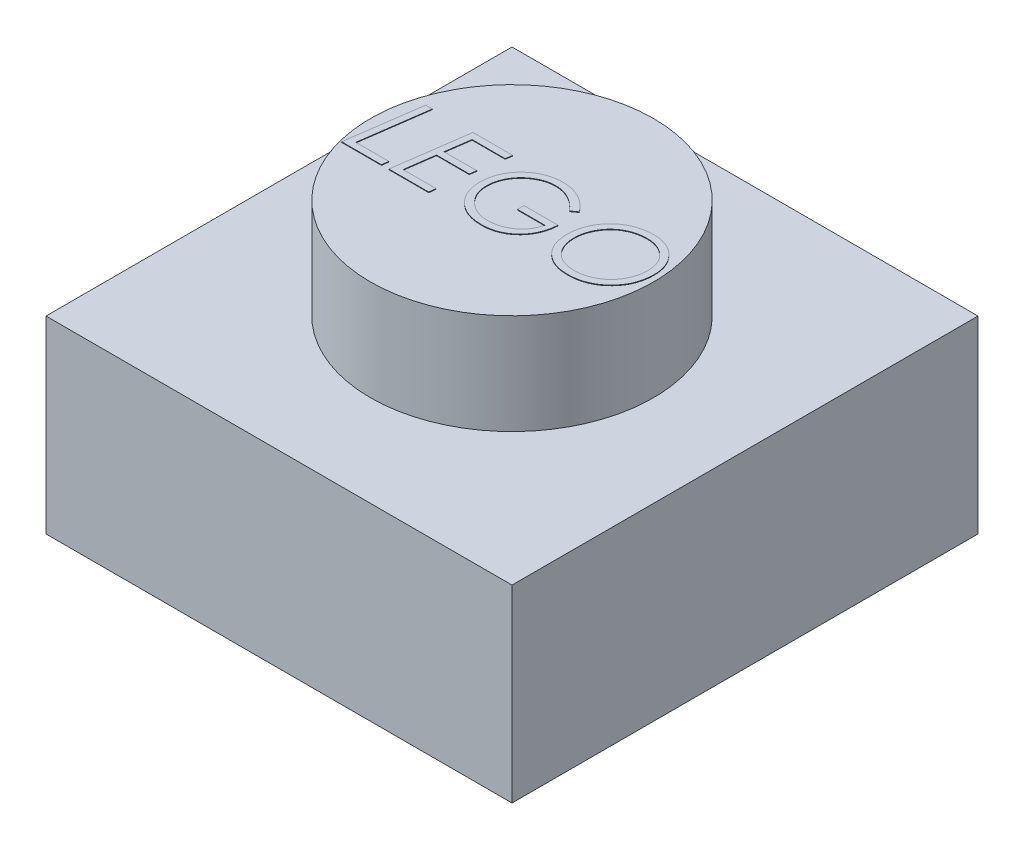
from build123d import *

# Parameters (mm, degrees)
SKETCH1_W           = 7.9
SKETCH1_H           = 7.9
BOSS_EXTRUDE1_DEPTH = 3.2
SKETCH2_R           = 2.4
BOSS_EXTRUDE2_DEPTH = 1.7
BOSS_EXTRUDE4_DEPTH = 0.01
SKETCH4_W           = 6.679581062
SKETCH4_H           = 6.679581062
CUT_EXTRUDE1_DEPTH  = 2.01
BOSS_EXTRUDE5_START = -2.01
SKETCH5_R           = 1.021947204
SKETCH5_R_2         = 1.041114876
SKETCH5_R_3         = 1.016069602
BOSS_EXTRUDE5_DEPTH = 2.01


with BuildPart() as part:
    # Sketch1 → Boss-Extrude1 (new body)
    with BuildSketch(Plane(origin=(0, 0, 0), x_dir=(1, 0, 0), z_dir=(0, 1, 0))):
        with Locations((3.95, 3.95)):
            Rectangle(SKETCH1_W, SKETCH1_H)
    extrude(amount=BOSS_EXTRUDE1_DEPTH)

    # Sketch2 → Boss-Extrude2 (add)
    with BuildSketch(Plane(origin=(0, 3.2, 0), x_dir=(1, 0, 0), z_dir=(0, 1, 0))):
        with Locations((3.95, 3.95)):
            Circle(SKETCH2_R)
    extrude(amount=BOSS_EXTRUDE2_DEPTH)

    # Sketch3 → Boss-Extrude4 (add)
    # profile 1 of 4: a face of its own
    with BuildSketch(Plane(origin=(0, 4.9, 0), x_dir=(1, 0, 0), z_dir=(0, 1, 0))):
        Polygon((1.832282536, 4.604898123), (1.945463626, 4.604898123), (1.785708017, 3.46707761), (2.346104652, 3.46707761), (2.331831815, 3.354898123), (1.657002088, 3.354898123), align=None)
    # profile 2 of 4: a face of its own
    with BuildSketch(Plane(origin=(0, 4.9, 0), x_dir=(1, 0, 0), z_dir=(0, 1, 0))):
        Polygon((3.307643113, 4.604898123), (3.289864668, 4.492718636), (2.730720036, 4.492718636), (2.672376687, 4.076051969), (3.227514908, 4.076051969), (3.211489267, 3.963872482), (2.656351046, 3.963872482), (2.586990069, 3.46707761), (3.147386703, 3.46707761), (3.132863466, 3.354898123), (2.458284139, 3.354898123), (2.633564588, 4.604898123), align=None)
    # profile 3 of 4: a face of its own
    with BuildSketch(Plane(origin=(0, 4.9, 0), x_dir=(1, 0, 0), z_dir=(0, 1, 0))):
        with BuildLine():
            Line((4.701873883, 4.341727049), (4.602214428, 4.268359661))
            add(Edge.make_bspline(
                [(4.602214428, 4.268359661), (4.594223081, 4.278463296), (4.578382454, 4.298490949), (4.552974208, 4.326751799), (4.526781942, 4.353389692), (4.49925824, 4.377917229), (4.471083571, 4.40112998), (4.441525281, 4.42204341), (4.410978563, 4.441207159), (4.379659496, 4.458649755), (4.347610579, 4.474125482), (4.315396207, 4.487732834), (4.282869127, 4.498922357), (4.250283005, 4.50864136), (4.217299487, 4.51587276), (4.18414763, 4.520710487), (4.150903008, 4.524293062), (4.128633082, 4.524610402), (4.117438786, 4.524769918)],
                knots=[0, 0, 0, 0, 1.088205139, 2.157064813, 3.209299296, 4.24303109, 5.270682624, 6.292193363, 7.299904734, 8.316436989, 9.319473328, 10.305733085, 11.269264382, 12.22444877, 13.177574148, 14.119122834, 15.054550362, 16, 16, 16, 16], degree=3))
            add(Edge.make_bspline(
                [(4.117438786, 4.524769918), (4.104994375, 4.524521107), (4.080132736, 4.524024028), (4.043033101, 4.520256885), (4.006376299, 4.51354748), (3.969908323, 4.504926578), (3.933893833, 4.493301772), (3.898252767, 4.479273564), (3.86309309, 4.462612711), (3.828430169, 4.443710217), (3.794953431, 4.422557236), (3.762954424, 4.399818018), (3.733183783, 4.375017311), (3.704650221, 4.34913067), (3.678490591, 4.320990985), (3.654040353, 4.291325456), (3.631570613, 4.259970376), (3.610753816, 4.22729124), (3.592321888, 4.193377608), (3.576332398, 4.158696131), (3.562301633, 4.123622124), (3.551463822, 4.087613068), (3.542488613, 4.051135011), (3.536702509, 4.013925289), (3.532682003, 3.976230124), (3.532229884, 3.950862463), (3.532002088, 3.938081216)],
                knots=[0, 0, 0, 0, 0.97704485, 1.95195533, 2.923843304, 3.901415526, 4.89212417, 5.89249681, 6.906854198, 7.94508701, 8.99059592, 10.014519948, 11.024825533, 12.031297736, 13.037428488, 14.038509295, 15.047964276, 16.064309815, 17.079005887, 18.075937854, 19.061713623, 20.042247028, 21.026191147, 22.008802999, 22.996754876, 24, 24, 24, 24], degree=3))
            add(Edge.make_bspline(
                [(3.532002088, 3.938081216), (3.532369323, 3.920940483), (3.533092921, 3.887166428), (3.54080397, 3.83756171), (3.552297071, 3.789703796), (3.569345009, 3.743984102), (3.590663785, 3.700113704), (3.616898701, 3.658340736), (3.647995923, 3.618632516), (3.683169388, 3.581124089), (3.721975609, 3.547190184), (3.762989457, 3.517071082), (3.806208637, 3.491553815), (3.851780792, 3.471217023), (3.899058754, 3.454481236), (3.948703848, 3.443615036), (4.000192874, 3.436168993), (4.035279814, 3.435410998), (4.053085822, 3.435026328)],
                knots=[0, 0, 0, 0, 1.019699772, 2.00921373, 2.981850619, 3.945611549, 4.907936516, 5.881372837, 6.876399243, 7.906447893, 8.938173367, 9.941073143, 10.932270214, 11.919723139, 12.908225854, 13.912405215, 14.940582182, 16, 16, 16, 16], degree=3))
            add(Edge.make_bspline(
                [(4.053085822, 3.435026328), (4.074581254, 3.435599426), (4.11748625, 3.436743331), (4.180872469, 3.447608002), (4.243162184, 3.464003995), (4.303115661, 3.48756372), (4.359892332, 3.516274774), (4.411741714, 3.54979345), (4.457784869, 3.587961635), (4.498384943, 3.630580026), (4.53303885, 3.678554542), (4.563120551, 3.731230233), (4.587740602, 3.789373269), (4.599634966, 3.830601123), (4.605720036, 3.851692995)],
                knots=[0, 0, 0, 0, 1.033792167, 2.063454529, 3.086685911, 4.12966393, 5.157365104, 6.144632769, 7.094686579, 8.02963692, 8.969786061, 9.935985671, 10.944065236, 12, 12, 12, 12], degree=3))
            Line((4.605720036, 3.851692995), (4.140976447, 3.851692995))
            Line((4.140976447, 3.851692995), (4.140976447, 3.963872482))
            Line((4.140976447, 3.963872482), (4.717899524, 3.963872482))
            add(Edge.make_bspline(
                [(4.717899524, 3.963872482), (4.715864452, 3.940537279), (4.711874195, 3.894782885), (4.69942647, 3.828086612), (4.68199329, 3.764774229), (4.659173945, 3.704861641), (4.630919519, 3.648505742), (4.59774963, 3.595348644), (4.559285746, 3.545571633), (4.515814341, 3.499721655), (4.46844757, 3.458302738), (4.417878433, 3.421925394), (4.364351012, 3.391393009), (4.308182236, 3.366007973), (4.248908241, 3.346854494), (4.187007442, 3.33278705), (4.12217798, 3.324364805), (4.078067373, 3.323359246), (4.055589828, 3.322846841)],
                knots=[0, 0, 0, 0, 1.098006248, 2.152910829, 3.176693714, 4.174102283, 5.154427425, 6.128677043, 7.108165613, 8.099464247, 9.087077226, 10.054952015, 11.015803916, 11.972468591, 12.940477937, 13.931877037, 14.946141749, 16, 16, 16, 16], degree=3))
            add(Edge.make_bspline(
                [(4.055589828, 3.322846841), (4.032525547, 3.323342362), (3.987411429, 3.324311611), (3.9214857, 3.332876212), (3.858807865, 3.34620412), (3.799404334, 3.365318809), (3.743277296, 3.389857102), (3.690679177, 3.420179827), (3.641268759, 3.455657405), (3.595689928, 3.496348401), (3.554559756, 3.541197331), (3.518567584, 3.589307242), (3.487743642, 3.639999747), (3.462901044, 3.693721351), (3.443468533, 3.750181555), (3.429856098, 3.809437188), (3.421311108, 3.871476007), (3.420325278, 3.913764014), (3.419822601, 3.935326809)],
                knots=[0, 0, 0, 0, 1.117903688, 2.186638197, 3.21780727, 4.221242465, 5.20706516, 6.182431358, 7.159609539, 8.151436913, 9.139682433, 10.10533578, 11.060397566, 12.011007066, 12.969638005, 13.950363306, 14.954883424, 16, 16, 16, 16], degree=3))
            add(Edge.make_bspline(
                [(3.419822601, 3.935326809), (3.420138952, 3.950859376), (3.420767729, 3.981731803), (3.424963713, 4.027616327), (3.432679126, 4.072646659), (3.442852825, 4.116910735), (3.455965552, 4.160496846), (3.471933961, 4.20328178), (3.491087489, 4.245242481), (3.513047729, 4.286115161), (3.537530339, 4.325600602), (3.564271155, 4.363247138), (3.593498243, 4.398542313), (3.624507556, 4.432098501), (3.658146201, 4.463054417), (3.693847346, 4.491888255), (3.731480716, 4.518905381), (3.77142415, 4.543221398), (3.812846375, 4.565137356), (3.855118915, 4.584605211), (3.898469674, 4.600573637), (3.942428974, 4.613905323), (3.987291028, 4.624144078), (4.032916476, 4.631801844), (4.079465257, 4.63599767), (4.110753822, 4.636631416), (4.12645321, 4.636949405)],
                knots=[0, 0, 0, 0, 1.01034602, 2.008157081, 2.993527994, 3.979930372, 4.960683832, 5.951959865, 6.948100503, 7.958563211, 8.967975239, 9.968308804, 10.959584837, 11.946808627, 12.938010319, 13.930059161, 14.930392727, 15.949048275, 16.969091794, 17.977364349, 18.973726886, 19.971641333, 20.963333569, 21.964771492, 22.978801278, 24, 24, 24, 24], degree=3))
            add(Edge.make_bspline(
                [(4.12645321, 4.636949405), (4.140647989, 4.63666956), (4.168739982, 4.636115737), (4.210476499, 4.63288549), (4.251380819, 4.627152534), (4.29129634, 4.618801418), (4.330484053, 4.608567941), (4.368675988, 4.59577053), (4.406070924, 4.580754735), (4.442474857, 4.563343269), (4.478143584, 4.543914061), (4.512619765, 4.521658579), (4.546625807, 4.497640881), (4.579591338, 4.471153536), (4.611552577, 4.442077414), (4.642675265, 4.410871755), (4.673242279, 4.377555225), (4.692243855, 4.353777591), (4.701873883, 4.341727049)],
                knots=[0, 0, 0, 0, 1.015105213, 2.008930748, 2.991454354, 3.966534974, 4.923490216, 5.886087319, 6.844809209, 7.803252371, 8.770243484, 9.747130909, 10.735853235, 11.746297741, 12.768902994, 13.824016992, 14.897208497, 16, 16, 16, 16], degree=3))
        make_face()
    # profile 4 of 4: a face of its own
    with BuildSketch(Plane(origin=(0, 4.9, 0), x_dir=(1, 0, 0), z_dir=(0, 1, 0))):
        with BuildLine():
            add(Edge.make_bspline(
                [(5.671925966, 4.636949405), (5.692400623, 4.63650345), (5.732667893, 4.635626396), (5.791703582, 4.627669814), (5.84816478, 4.614697282), (5.901922783, 4.596339067), (5.953136821, 4.572927607), (6.001690741, 4.544284414), (6.047399306, 4.510158163), (6.09025375, 4.471611385), (6.129154607, 4.429051867), (6.163160058, 4.383201547), (6.192058383, 4.334734533), (6.215910086, 4.283554512), (6.233823478, 4.229366588), (6.246743033, 4.172603876), (6.255145963, 4.113110877), (6.255950492, 4.072491917), (6.256361062, 4.051763107)],
                knots=[0, 0, 0, 0, 1.061681398, 2.087996504, 3.083659545, 4.062660971, 5.02945529, 5.999994507, 6.981138296, 7.983640916, 8.985844288, 9.966988076, 10.939736476, 11.908342154, 12.890058995, 13.894159216, 14.925339913, 16, 16, 16, 16], degree=3))
            add(Edge.make_bspline(
                [(6.256361062, 4.051763107), (6.25623821, 4.038988627), (6.255995471, 4.01374805), (6.253408976, 3.976225127), (6.249128591, 3.939561124), (6.243455349, 3.903597875), (6.235835613, 3.868539787), (6.226924527, 3.834140064), (6.216051359, 3.800598383), (6.20384118, 3.767696929), (6.189792262, 3.735595516), (6.173946521, 3.704324105), (6.15669213, 3.673663515), (6.137607818, 3.643838863), (6.11686312, 3.614849105), (6.094393683, 3.586665409), (6.070489857, 3.559187301), (6.044887258, 3.532733386), (6.018336956, 3.507212599), (5.990529993, 3.48355884), (5.962091012, 3.461350566), (5.932834084, 3.440746086), (5.90250067, 3.422121085), (5.871581935, 3.404690573), (5.839905885, 3.388861691), (5.807185809, 3.375183309), (5.773789823, 3.362832151), (5.739620564, 3.352089492), (5.704582969, 3.343076229), (5.668762424, 3.335500733), (5.632062087, 3.329787275), (5.594535036, 3.325855801), (5.556279304, 3.323200874), (5.530454147, 3.322965537), (5.51742877, 3.322846841)],
                knots=[0, 0, 0, 0, 1.057694632, 2.089855924, 3.112648636, 4.113725536, 5.103331559, 6.082381806, 7.055068159, 8.021768845, 8.98743121, 9.954922249, 10.923671581, 11.89959402, 12.885451751, 13.874212627, 14.883322035, 15.900071676, 16.921812937, 17.931632203, 18.921551953, 19.909055848, 20.892997665, 21.867769094, 22.84762411, 23.823252803, 24.802912784, 25.795362855, 26.787788858, 27.797679081, 28.826061376, 29.861826465, 30.921574152, 32, 32, 32, 32], degree=3))
            add(Edge.make_bspline(
                [(5.51742877, 3.322846841), (5.495540081, 3.323312388), (5.45279647, 3.324221496), (5.390401025, 3.331753811), (5.331466149, 3.34468508), (5.275615882, 3.361975519), (5.223270197, 3.38492417), (5.174339628, 3.412892082), (5.128783581, 3.445910526), (5.086763869, 3.483632016), (5.049135515, 3.525626819), (5.016044394, 3.570822838), (4.988418107, 3.619388761), (4.96538613, 3.670881503), (4.948106883, 3.725740589), (4.935156589, 3.783416472), (4.927613141, 3.844314319), (4.926699871, 3.88597706), (4.926232857, 3.907281937)],
                knots=[0, 0, 0, 0, 1.121422378, 2.189881799, 3.214223923, 4.209829567, 5.180887389, 6.136870002, 7.092517675, 8.058664933, 9.02481219, 9.976998316, 10.923432162, 11.882748215, 12.86205079, 13.865508147, 14.908495107, 16, 16, 16, 16], degree=3))
            add(Edge.make_bspline(
                [(4.926232857, 3.907281937), (4.92651465, 3.92390256), (4.927073619, 3.956871533), (4.931757127, 4.005792823), (4.939128338, 4.053761359), (4.950024433, 4.100549976), (4.963594459, 4.14639076), (4.979990494, 4.191253803), (5.000003008, 4.234848241), (5.022452359, 4.277389438), (5.047513645, 4.318359564), (5.07559856, 4.356880644), (5.105216605, 4.393691441), (5.137816677, 4.42780852), (5.172496353, 4.459796588), (5.209524734, 4.489546335), (5.248906172, 4.516814917), (5.290422211, 4.541753927), (5.333531205, 4.564369022), (5.378335052, 4.583562961), (5.424193072, 4.600182058), (5.471345954, 4.613795807), (5.519847317, 4.623918047), (5.569406413, 4.631466127), (5.620254649, 4.636113027), (5.6545551, 4.636668231), (5.671925966, 4.636949405)],
                knots=[0, 0, 0, 0, 1.027038055, 2.037251559, 3.03463374, 4.024476576, 5.003805404, 5.987972729, 6.973761106, 7.966047439, 8.95963362, 9.938921687, 10.910571097, 11.877553313, 12.852319973, 13.824735949, 14.81069978, 15.81041387, 16.816403723, 17.816876174, 18.82042938, 19.829469955, 20.847307225, 21.880377804, 22.926554263, 24, 24, 24, 24], degree=3))
        make_face()
        with BuildLine():
            add(Edge.make_bspline(
                [(5.671925966, 4.524769918), (5.65697579, 4.524545747), (5.627444828, 4.524102944), (5.583747158, 4.520086709), (5.541191397, 4.514393729), (5.499970629, 4.505322476), (5.459846772, 4.494612055), (5.421182876, 4.480527241), (5.383524652, 4.464643931), (5.34726264, 4.446055377), (5.312516644, 4.425361321), (5.279529586, 4.402463835), (5.248469657, 4.377453479), (5.219370347, 4.350164922), (5.191739723, 4.321307483), (5.166361885, 4.289965789), (5.142845474, 4.256628787), (5.121196386, 4.221501346), (5.10164712, 4.185107003), (5.08492909, 4.147719282), (5.070612165, 4.109847114), (5.058744989, 4.071497155), (5.049737471, 4.032481304), (5.043287884, 3.99291855), (5.039049877, 3.95269661), (5.03862585, 3.92565532), (5.038412344, 3.912039549)],
                knots=[0, 0, 0, 0, 1.093710758, 2.16039807, 3.20900896, 4.233234191, 5.246749975, 6.245527847, 7.241594159, 8.235879922, 9.224691631, 10.198908654, 11.171861231, 12.139893662, 13.116290872, 14.093089164, 15.087825051, 16.099756899, 17.110766713, 18.108591704, 19.094380672, 20.071961556, 21.043859171, 22.021859724, 23.00397114, 24, 24, 24, 24], degree=3))
            add(Edge.make_bspline(
                [(5.038412344, 3.912039549), (5.038625982, 3.900599914), (5.039049193, 3.877938292), (5.041777549, 3.844392517), (5.046595514, 3.811801965), (5.053065301, 3.780081073), (5.061542906, 3.749273697), (5.072183234, 3.719394567), (5.084405544, 3.690349568), (5.098393626, 3.662290632), (5.114175341, 3.635553687), (5.131389377, 3.61020951), (5.150226394, 3.586682218), (5.170360361, 3.564729612), (5.191972025, 3.544421151), (5.214980987, 3.52555365), (5.239648771, 3.508615875), (5.265465573, 3.492943288), (5.292687864, 3.479247808), (5.321165948, 3.467438697), (5.350786278, 3.457432665), (5.381544214, 3.449135171), (5.413524888, 3.442928532), (5.44663118, 3.438448028), (5.480905707, 3.435639812), (5.504152208, 3.435232585), (5.515926367, 3.435026328)],
                knots=[0, 0, 0, 0, 1.083699529, 2.146780792, 3.185591126, 4.202843058, 5.211856999, 6.209655863, 7.20532214, 8.195415879, 9.177202942, 10.14436246, 11.095191523, 12.029705806, 12.963818608, 13.902338257, 14.845476191, 15.796042213, 16.761390084, 17.729066592, 18.714222808, 19.721158958, 20.74459932, 21.797962164, 22.884686177, 24, 24, 24, 24], degree=3))
            add(Edge.make_bspline(
                [(5.515926367, 3.435026328), (5.530044188, 3.435228857), (5.558004277, 3.435629962), (5.599524853, 3.440000997), (5.64032433, 3.445959686), (5.680325762, 3.455225454), (5.71965402, 3.466535035), (5.757982705, 3.481070895), (5.795756024, 3.497476377), (5.83237428, 3.51683082), (5.867802238, 3.538111172), (5.901266528, 3.561837848), (5.932774032, 3.587459191), (5.962816859, 3.614626895), (5.990234918, 3.644356353), (6.016009711, 3.675809964), (6.039684501, 3.709331455), (6.061465654, 3.744601276), (6.080935982, 3.781209824), (6.097718361, 3.818903041), (6.112024773, 3.857287248), (6.123844079, 3.896320217), (6.132886835, 3.936161865), (6.139301688, 3.976648339), (6.14355343, 4.017951988), (6.143970816, 4.04574289), (6.144181575, 4.059775927)],
                knots=[0, 0, 0, 0, 1.029812959, 2.039525905, 3.043952503, 4.036919093, 5.033391511, 6.027870106, 7.026035071, 8.036794627, 9.047957848, 10.039952554, 11.027355318, 12.010276797, 12.992858524, 13.975534638, 14.976019862, 15.985163142, 16.99876328, 17.999396818, 18.993875413, 19.986244033, 20.973271002, 21.972624612, 22.976275263, 24, 24, 24, 24], degree=3))
            add(Edge.make_bspline(
                [(6.144181575, 4.059775927), (6.143688983, 4.077993105), (6.142724583, 4.113658826), (6.13551886, 4.16576722), (6.122807184, 4.214771606), (6.105892747, 4.261149785), (6.083400704, 4.304354629), (6.056090597, 4.344736825), (6.024020374, 4.382453222), (5.999069145, 4.404451295), (5.986429171, 4.415595238)],
                knots=[0, 0, 0, 0, 1.085318323, 2.124844004, 3.126009127, 4.096923137, 5.060061729, 6.020100862, 6.997008382, 8, 8, 8, 8], degree=3))
            add(Edge.make_bspline(
                [(5.986429171, 4.415595238), (5.97539623, 4.42431843), (5.953439426, 4.44167857), (5.917982347, 4.463870828), (5.881057133, 4.482788681), (5.842389242, 4.498145486), (5.802091847, 4.510165945), (5.760106575, 4.518646998), (5.716539836, 4.523741692), (5.686963766, 4.524423338), (5.671925966, 4.524769918)],
                knots=[0, 0, 0, 0, 0.992364662, 1.974918139, 2.947382948, 3.917989177, 4.907989082, 5.912266894, 6.938502841, 8, 8, 8, 8], degree=3))
        make_face(mode=Mode.SUBTRACT)
    extrude(amount=BOSS_EXTRUDE4_DEPTH)

    # Sketch4 → Cut-Extrude1 (cut)
    with BuildSketch(Plane.XZ):
        with Locations((3.960209469, -3.960209469)):
            Rectangle(SKETCH4_W, SKETCH4_H)
    extrude(amount=-CUT_EXTRUDE1_DEPTH, mode=Mode.SUBTRACT)

    # Sketch5 → Boss-Extrude5 (add)
    with BuildSketch(Plane(origin=(0, 3.2, 0), x_dir=(1, 0, 0), z_dir=(0, 1, 0)).offset(BOSS_EXTRUDE5_START)):
        with Locations((1.458127833, 1.557811677)):
            Circle(SKETCH5_R)
        with Locations((1.458127833, 6.365232327)):
            Circle(SKETCH5_R_2)
        with BuildLine():
            ThreePointArc((5.605437996, 2.21232194), (7.084971092, 0.850452311), (5.706377057, 2.31441459))
            ThreePointArc((5.706377057, 2.31441459), (5.656671092, 2.262613327), (5.605437996, 2.21232194))
        make_face()
        with Locations((6.369527619, 6.365232327)):
            Circle(SKETCH5_R_3)
    extrude(amount=BOSS_EXTRUDE5_DEPTH)


solid = part.part
